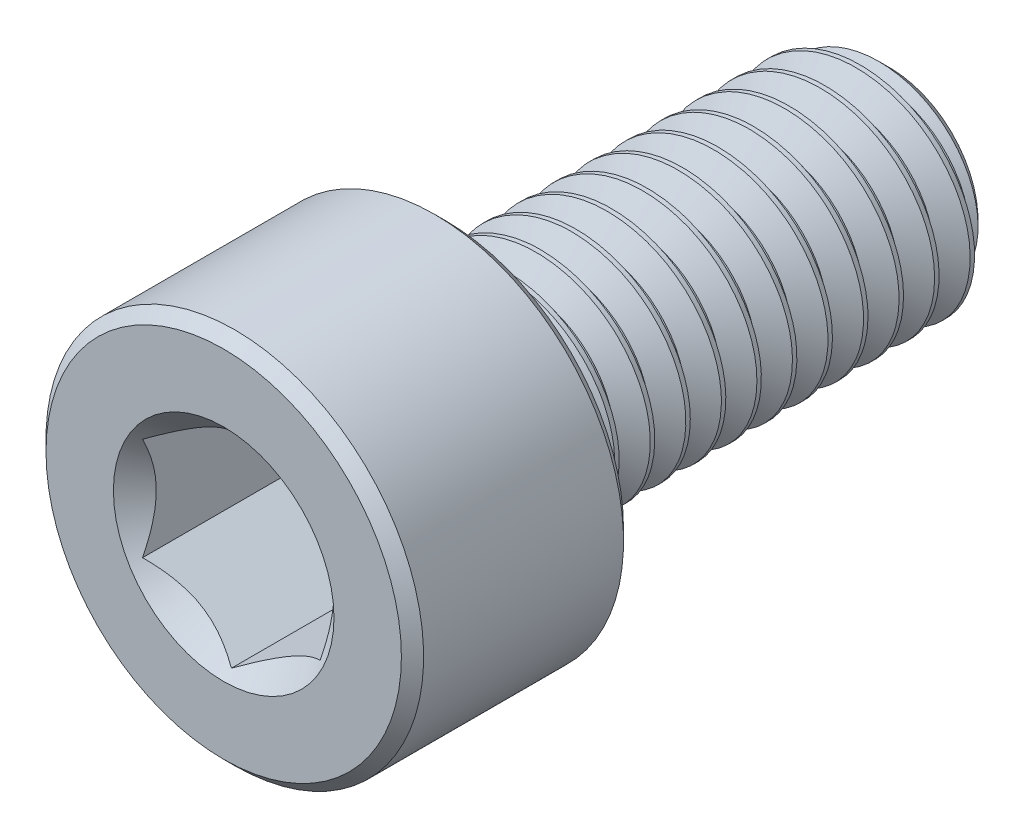
from build123d import *

# Parameters (mm, degrees)
CUT_EXTRUDE1_DEPTH     = 4
SPLIT1_SURFACE_1_BACK  = 20.222
SPLIT1_SURFACE_1_DEPTH = 40.444
SPLIT1_SURFACE_2_BACK  = 20.222
SPLIT1_SURFACE_2_DEPTH = 40.444
CUT_SWEEP1_PITCH       = 0.8


with BuildPart() as part:
    # Sketch2 → Revolve1 (revolve)
    with BuildSketch(Plane(origin=(0, 0, 0), x_dir=(0, 0, -1), z_dir=(1, 0, 0))):
        with BuildLine():
            Line((-7.5, 0), (-7.5, 4))
            Line((-7.5, 4), (-7.25, 4.25))
            Line((-7.25, 4.25), (-2.75, 4.25))
            Line((-2.75, 4.25), (-2.5, 4))
            Line((-2.5, 4), (-2.5, 2.75))
            ThreePointArc((-2.5, 2.75), (-2.426776695, 2.573223305), (-2.25, 2.5))
            Line((-2.25, 2.5), (6.980384758, 2.5))
            Line((6.980384758, 2.5), (7.5, 1.980384758))
            Line((7.5, 1.980384758), (7.5, 0))
            Line((7.5, 0), (-7.5, 0))
        make_face()
    revolve(axis=Axis((0, 0, -7.5), (0, 0, 1)))

    # Sketch3 → Cut-Extrude1 (cut)
    with BuildSketch(Plane.XY.offset(7.5)):
        Polygon((2, -1.154700538), (2, 1.154700538), (0, 2.309401077), (-2, 1.154700538), (-2, -1.154700538), (0, -2.309401077), align=None)
    extrude(amount=-CUT_EXTRUDE1_DEPTH, mode=Mode.SUBTRACT)

    # Cut-Extrude2 cone 1 section (through the dimple's axis) → Cut-Extrude2 (revolve, cut)
    with BuildSketch(Plane(origin=(0, 0, 7.5), x_dir=(0, -1, 0), z_dir=(1, 0, 0))):
        Polygon((0, 0), (2.482606158, 0), (0, 2.482606158), align=None)
    revolve(axis=Axis((0, 0, 7.5), (0, 0, -1)), mode=Mode.SUBTRACT)


with BuildPart() as body_2:
    # Split1: the piece behind the surface
    add(part.part)
    # Split1 surface: a surface, the sketch's curves swept straight by 40.444 mm
    with BuildLine(Plane(origin=(0, 0, 0), x_dir=(0, 0, -1), z_dir=(1, 0, 0)).offset(-SPLIT1_SURFACE_1_BACK), mode=Mode.PRIVATE) as split1_surface_1_path:
        Line((-2.25, -4.25), (-2.25, 4.25))
    split1_surface_1 = Shell.extrude(split1_surface_1_path.wire(), (1 * SPLIT1_SURFACE_1_DEPTH, 0 * SPLIT1_SURFACE_1_DEPTH, 0 * SPLIT1_SURFACE_1_DEPTH))
    split(bisect_by=split1_surface_1, keep=Keep.BOTTOM)

    # Cut-Sweep1: the profile of Sketch7 screwed along a right-hand helix of 13.5 turns, 8 arcs to a turn; built about Z, then put on its axis
    cut_sweep1_z = Axis((0, 0, 0), (0, 0, 1))
    cut_sweep1_corners = [(2.54330127, 0, 0.025), (2.54330127, 0, -0.725), (1.980384758, 0, -0.4), (1.980384758, 0, -0.3)]
    with BuildLine(mode=Mode.PRIVATE) as cut_sweep1_profile:
        Line(cut_sweep1_corners[0], cut_sweep1_corners[1])
        Line(cut_sweep1_corners[1], cut_sweep1_corners[2])
        Line(cut_sweep1_corners[2], cut_sweep1_corners[3])
        Line(cut_sweep1_corners[3], cut_sweep1_corners[0])
    cut_sweep1_cap = Face(cut_sweep1_profile.wire())
    cut_sweep1_turn_angles = [0, 22.5, 45, 67.5, 90, 112.5, 135, 157.5, 180, 202.5, 225, 247.5, 270, 292.5, 315, 337.5, 360]
    cut_sweep1_turn_weights = [1, 0.9238795325112867, 1, 0.9238795325112867, 1, 0.9238795325112867, 1, 0.9238795325112867, 1, 0.9238795325112867, 1, 0.9238795325112867, 1, 0.9238795325112867, 1, 0.9238795325112867, 1]
    cut_sweep1_turn_rails = [Edge.make_bspline([Vector(p[0], p[1], 0).rotate(cut_sweep1_z, cut_sweep1_turn_angles[k]) / cut_sweep1_turn_weights[k] + Vector(0, 0, p[2] + CUT_SWEEP1_PITCH * cut_sweep1_turn_angles[k] / 360) for k in range(17)], [0, 0, 0, 1, 1, 2, 2, 3, 3, 4, 4, 5, 5, 6, 6, 7, 7, 8, 8, 8], 2, cut_sweep1_turn_weights) for p in cut_sweep1_corners]
    cut_sweep1_turn_sides = [Face.make_surface_from_curves(cut_sweep1_turn_rails[p[0]], cut_sweep1_turn_rails[p[1]]) for p in [(0, 1), (1, 2), (2, 3), (3, 0)]]
    cut_sweep1_last_angles = [4680, 4702.5, 4725, 4747.5, 4770, 4792.5, 4815, 4837.5, 4860]
    cut_sweep1_last_weights = [1, 0.9238795325112867, 1, 0.9238795325112867, 1, 0.9238795325112867, 1, 0.923879532511223, 1]
    cut_sweep1_last_rails = [Edge.make_bspline([Vector(p[0], p[1], 0).rotate(cut_sweep1_z, cut_sweep1_last_angles[k]) / cut_sweep1_last_weights[k] + Vector(0, 0, p[2] + CUT_SWEEP1_PITCH * cut_sweep1_last_angles[k] / 360) for k in range(9)], [0, 0, 0, 1, 1, 2, 2, 3, 3, 4, 4, 4], 2, cut_sweep1_last_weights) for p in cut_sweep1_corners]
    cut_sweep1_last_sides = [Face.make_surface_from_curves(cut_sweep1_last_rails[p[0]], cut_sweep1_last_rails[p[1]]) for p in [(0, 1), (1, 2), (2, 3), (3, 0)]]
    cut_sweep1 = Plane(origin=(0, 0, -7.5), x_dir=(0, 1, 0), z_dir=(0, 0, 1)) * Solid(Shell([*[p.moved(Location((0, 0, CUT_SWEEP1_PITCH * i))) for i in range(13) for p in cut_sweep1_turn_sides], *cut_sweep1_last_sides, cut_sweep1_cap, cut_sweep1_cap.rotate(cut_sweep1_z, 4860).moved(Location((0, 0, CUT_SWEEP1_PITCH * 4860 / 360)))]))
    add(cut_sweep1, mode=Mode.SUBTRACT)


with BuildPart() as part_1:
    add(part.part)

    # Split1: split by a surface, the side it looks to stays
    # Split1 surface: a surface, the sketch's curves swept straight by 40.444 mm
    with BuildLine(Plane(origin=(0, 0, 0), x_dir=(0, 0, -1), z_dir=(1, 0, 0)).offset(-SPLIT1_SURFACE_2_BACK), mode=Mode.PRIVATE) as split1_surface_2_path:
        Line((-2.25, -4.25), (-2.25, 4.25))
    split1_surface_2 = Shell.extrude(split1_surface_2_path.wire(), (1 * SPLIT1_SURFACE_2_DEPTH, 0 * SPLIT1_SURFACE_2_DEPTH, 0 * SPLIT1_SURFACE_2_DEPTH))
    split(bisect_by=split1_surface_2, keep=Keep.TOP)

    add(body_2.part)  # Revolve2 merges body 2
    # Sketch8 → Revolve2 (revolve)
    with BuildSketch(Plane(origin=(0, 0, 0), x_dir=(0, 0, -1), z_dir=(1, 0, 0)), mode=Mode.PRIVATE) as revolve2_sk:
        Polygon((-2.5, 0), (-2.5, 2.5), (-2.25, 2.5), (-0.806624327, 0), align=None)
    revolve(revolve2_sk.sketch.rotate(Axis((0, 0, 0.806624327), (0, 0, 1)), 270), axis=Axis((0, 0, 0.806624327), (0, 0, 1)))


solid = part_1.part
